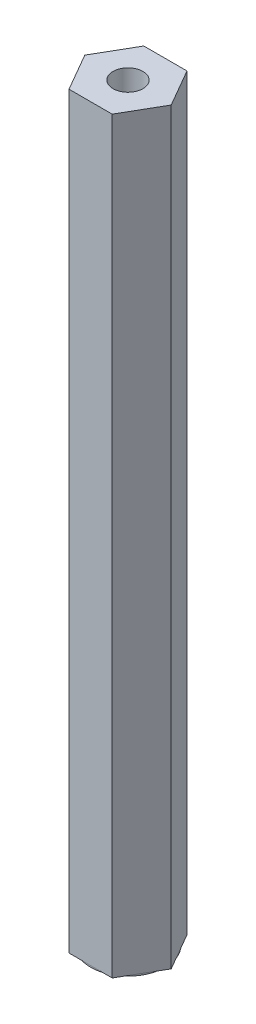
from build123d import *

# Parameters (mm, degrees)
BOSS_EXTRUDE1_DEPTH = 127
SKETCH2_R           = 2.54
CUT_EXTRUDE1_DEPTH  = 25.4
SKETCH3_R           = 6.35
BOSS_EXTRUDE2_DEPTH = 0.254


with BuildPart() as part:
    # Sketch1 → Boss-Extrude1 (new body)
    with BuildSketch(Plane(origin=(0, 0, 0), x_dir=(1, 0, 0), z_dir=(0, 1, 0))):
        Polygon((7.332348419, 0), (3.666174209, 6.35), (-3.666174209, 6.35), (-7.332348419, 0), (-3.666174209, -6.35), (3.666174209, -6.35), align=None)
    extrude(amount=BOSS_EXTRUDE1_DEPTH)

    # Sketch2 → Cut-Extrude1 (cut)
    with BuildSketch(Plane(origin=(0, 127, 0), x_dir=(1, 0, 0), z_dir=(0, 1, 0))):
        Circle(SKETCH2_R)
    extrude(amount=-CUT_EXTRUDE1_DEPTH, mode=Mode.SUBTRACT)

    # Sketch3 → Boss-Extrude2 (add)
    with BuildSketch(Plane.XZ):
        Circle(SKETCH3_R)
    extrude(amount=BOSS_EXTRUDE2_DEPTH)


solid = part.part
